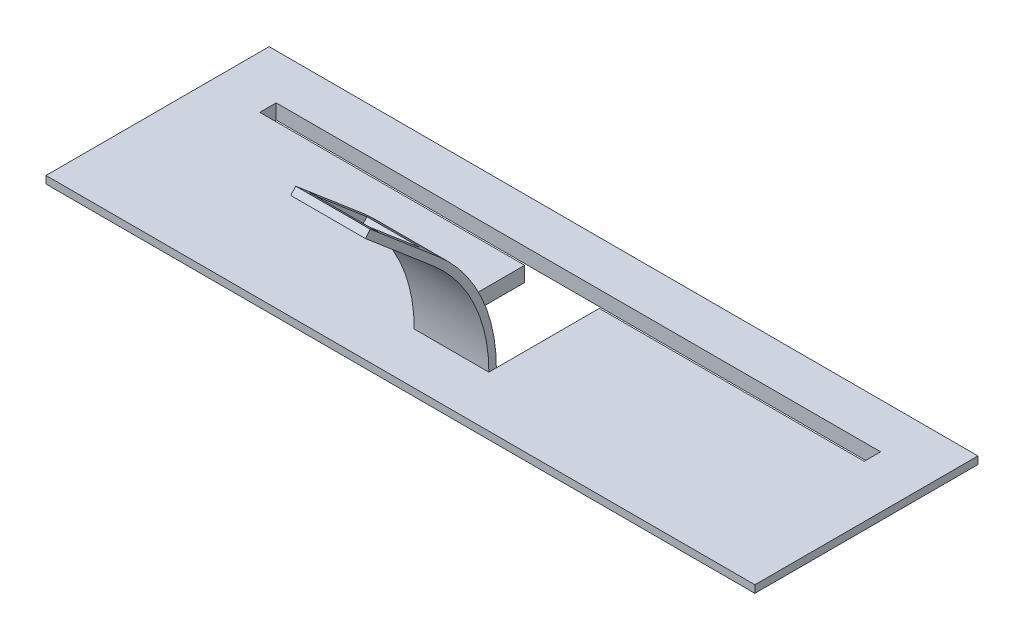
from build123d import *

# Parameters (mm, degrees)
SKETCH1_W                = 234.95
SKETCH1_H                = 69.596
BOSS_EXTRUDE1_DEPTH      = 2.54
SKETCH2_W                = 241.3
SKETCH2_H                = 75.946
BOSS_EXTRUDE2_DEPTH      = 2.54
CUT_EXTRUDE2_DEPTH       = 127.5866408
BOSS_EXTRUDE7_DEPTH      = 12.7
BOSS_EXTRUDE7_DEPTH_BACK = 12.7
SKETCH5_W                = 25.4
SKETCH5_H                = 2.54
BOSS_EXTRUDE8_DEPTH      = 30.48
CUT_EXTRUDE3_REACH       = 153.329
SKETCH6_W                = 18.288
SKETCH6_H                = 23.01875
CUT_EXTRUDE4_REACH       = 153.329
SKETCH9_R                = 1


with BuildPart() as part:
    # Sketch1 → Boss-Extrude1 (new body)
    with BuildSketch(Plane(origin=(0, 0, 0), x_dir=(1, 0, 0), z_dir=(0, 1, 0))):
        Rectangle(SKETCH1_W, SKETCH1_H)
    extrude(amount=BOSS_EXTRUDE1_DEPTH)

    # Sketch2 → Boss-Extrude2 (add)
    with BuildSketch(Plane(origin=(0, 2.54, 0), x_dir=(1, 0, 0), z_dir=(0, 1, 0))):
        Rectangle(SKETCH2_W, SKETCH2_H)
    extrude(amount=BOSS_EXTRUDE2_DEPTH)

    # Sketch3 → Cut-Extrude2 (cut, through all)
    with BuildSketch(Plane(origin=(0, 5.08, 0), x_dir=(1, 0, 0), z_dir=(0, 1, 0))):
        Polygon((102.87, 22.606), (-102.87, 22.606), (-102.87, 17.018), (-12.7, 17.018), (-12.7, -18.034), (12.7, -18.034), (12.7, 17.018), (102.87, 17.018), align=None)
    extrude(amount=-CUT_EXTRUDE2_DEPTH, mode=Mode.SUBTRACT)

    # Sketch4 → Boss-Extrude7 (add, two sides: drawn at the far end of the back side and taken through both)
    with BuildSketch(Plane(origin=(0, 0, 0), x_dir=(0, 0, -1), z_dir=(1, 0, 0)).offset(-BOSS_EXTRUDE7_DEPTH_BACK)):
        with BuildLine():
            Line((-20.574, 5.08), (-18.034, 5.08))
            ThreePointArc((-18.034, 5.08), (-23.194025065, 28.533326897), (-37.721134665, 47.655238095))
            Line((-37.721134665, 47.655238095), (-39.366264908, 45.72))
            ThreePointArc((-39.366264908, 45.72), (-25.499478471, 27.467266584), (-20.574, 5.08))
        make_face()
    extrude(amount=BOSS_EXTRUDE7_DEPTH + BOSS_EXTRUDE7_DEPTH_BACK)

    # Sketch5 → Boss-Extrude8 (add)
    with BuildSketch(Plane(origin=(0, 38.605953422, 45.413858329), x_dir=(1, 0, 0), z_dir=(0, 0.6476890718445453, 0.7619047619047618))):
        with Locations((0, 10.607186134)):
            Rectangle(SKETCH5_W, SKETCH5_H)
    extrude(amount=BOSS_EXTRUDE8_DEPTH)

    # Sketch6 → Cut-Extrude3 (cut, up to next)
    with BuildSketch(Plane(origin=(0, 9.049284674, -7.692723663), x_dir=(1, 0, 0), z_dir=(0, 0.7619047619047616, -0.6476890718445452)), mode=Mode.PRIVATE) as cut_extrude3_sk1:
        with Locations((0, -74.455715595)):
            Rectangle(SKETCH6_W, SKETCH6_H)
    cut_extrude3_tool1 = extrude(cut_extrude3_sk1.sketch, amount=-CUT_EXTRUDE3_REACH, mode=Mode.PRIVATE) & part.part
    add(cut_extrude3_tool1.solids().sort_by_distance((0, 57.273438, 49.035441))[0], mode=Mode.SUBTRACT)

    # Sketch9 → Cut-Extrude4 (cut, up to next)
    with BuildSketch(Plane(origin=(0, 9.049284674, -7.692723663), x_dir=(1, 0, 0), z_dir=(0, 0.7619047619047616, -0.6476890718445452)), mode=Mode.PRIVATE) as cut_extrude4_sk1:
        with Locations((-10.31875, -85.171340595)):
            Circle(SKETCH9_R)
    cut_extrude4_tool1 = extrude(cut_extrude4_sk1.sketch, amount=-CUT_EXTRUDE4_REACH, mode=Mode.PRIVATE) & part.part
    # Sketch9 → Cut-Extrude4 (cut, up to next)
    with BuildSketch(Plane(origin=(0, 9.049284674, -7.692723663), x_dir=(1, 0, 0), z_dir=(0, 0.7619047619047616, -0.6476890718445452)), mode=Mode.PRIVATE) as cut_extrude4_sk2:
        with Locations((10.31875, -85.171340595)):
            Circle(SKETCH9_R)
    cut_extrude4_tool2 = extrude(cut_extrude4_sk2.sketch, amount=-CUT_EXTRUDE4_REACH, mode=Mode.PRIVATE) & part.part
    add(cut_extrude4_tool1.solids().sort_by_distance((-10.31875, 64.213831, 57.199726))[0], mode=Mode.SUBTRACT)
    add(cut_extrude4_tool2.solids().sort_by_distance((10.31875, 64.213831, 57.199726))[0], mode=Mode.SUBTRACT)


solid = part.part
